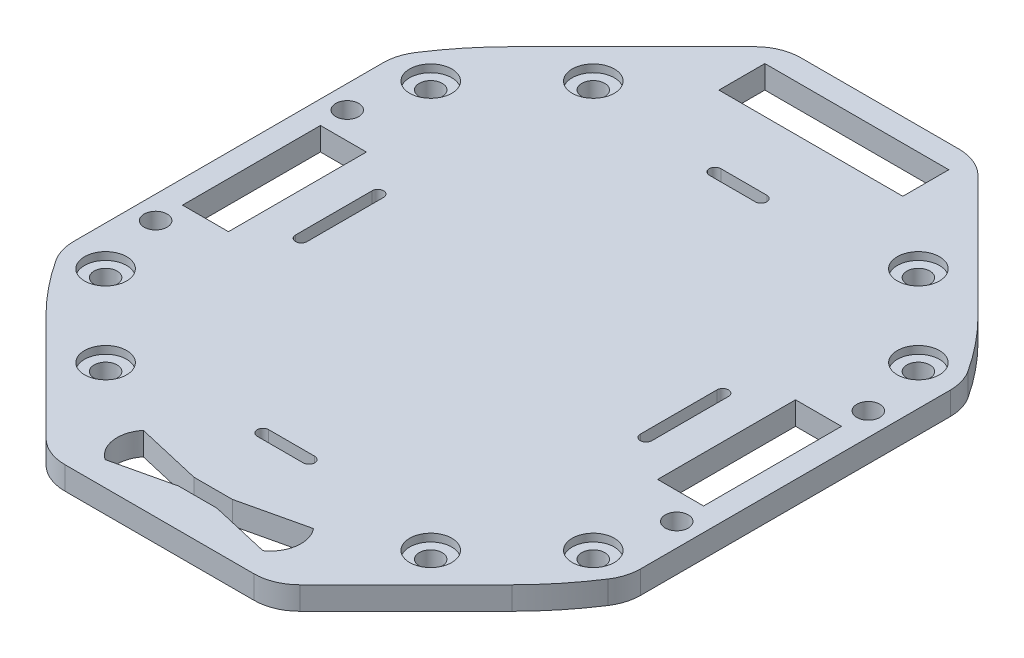
from build123d import *

# Parameters (mm, degrees)
SKETCH_1_R          = 1.5
EXTRUDE_1_DEPTH     = 3
SKETCH_2_R          = 2.75
CUT_EXTRUDE_1_DEPTH = 1
SKETCH_3_R          = 1.5
SKETCH_3_W          = 24
SKETCH_3_H          = 6
SKETCH_3_W_2        = 6
SKETCH_3_H_2        = 18
CUT_EXTRUDE_2_DEPTH = 10
CUT_EXTRUDE_3_DEPTH = 10
EXTRUDE_2_DEPTH     = 3
CUT_EXTRUDE_4_DEPTH = 3


with BuildPart() as part:
    # 草图1 → 凸台-拉伸1 (new body)
    with BuildSketch(Plane(origin=(0, 0, 0), x_dir=(1, 0, 0), z_dir=(0, 1, 0))):
        with BuildLine():
            Line((-10.325901808, 48), (10.325901808, 48))
            ThreePointArc((10.325901808, 48), (12.622002402, 47.543277195), (14.568542495, 46.242640687))
            Line((14.568542495, 46.242640687), (30.405591591, 30.405591591))
            ThreePointArc((30.405591591, 30.405591591), (33.396603497, 27.086285733), (36.027027027, 23.474524992))
            ThreePointArc((36.027027027, 23.474524992), (36.751615519, 21.907494269), (37, 20.199009877))
            Line((37, 20.199009877), (37, -20.199009877))
            ThreePointArc((37, -20.199009877), (36.751615519, -21.907494269), (36.027027027, -23.474524992))
            ThreePointArc((36.027027027, -23.474524992), (33.396603497, -27.086285733), (30.405591591, -30.405591591))
            Line((30.405591591, -30.405591591), (14.568542495, -46.242640687))
            ThreePointArc((14.568542495, -46.242640687), (12.622002402, -47.543277195), (10.325901808, -48))
            Line((10.325901808, -48), (-10.325901808, -48))
            ThreePointArc((-10.325901808, -48), (-12.622002402, -47.543277195), (-14.568542495, -46.242640687))
            Line((-14.568542495, -46.242640687), (-30.405591591, -30.405591591))
            ThreePointArc((-30.405591591, -30.405591591), (-33.396603497, -27.086285733), (-36.027027027, -23.474524992))
            ThreePointArc((-36.027027027, -23.474524992), (-36.751615519, -21.907494269), (-37, -20.199009877))
            Line((-37, -20.199009877), (-37, 20.199009877))
            ThreePointArc((-37, 20.199009877), (-36.751615519, 21.907494269), (-36.027027027, 23.474524992))
            ThreePointArc((-36.027027027, 23.474524992), (-33.396603497, 27.086285733), (-30.405591591, 30.405591591))
            Line((-30.405591591, 30.405591591), (-14.568542495, 46.242640687))
            ThreePointArc((-14.568542495, 46.242640687), (-12.622002402, 47.543277195), (-10.325901808, 48))
        make_face()
        with Locations((-21.213203436, 31.819805153)):
            Circle(SKETCH_1_R, mode=Mode.SUBTRACT)
        with Locations((-31.819805153, 21.213203436)):
            Circle(SKETCH_1_R, mode=Mode.SUBTRACT)
        with Locations((31.819805153, 21.213203436)):
            Circle(SKETCH_1_R, mode=Mode.SUBTRACT)
        with Locations((21.213203436, 31.819805153)):
            Circle(SKETCH_1_R, mode=Mode.SUBTRACT)
        with Locations((-31.819805153, -21.213203436)):
            Circle(SKETCH_1_R, mode=Mode.SUBTRACT)
        with Locations((-21.213203436, -31.819805153)):
            Circle(SKETCH_1_R, mode=Mode.SUBTRACT)
        with Locations((31.819805153, -21.213203436)):
            Circle(SKETCH_1_R, mode=Mode.SUBTRACT)
        with Locations((21.213203436, -31.819805153)):
            Circle(SKETCH_1_R, mode=Mode.SUBTRACT)
    extrude(amount=EXTRUDE_1_DEPTH)

    # 草图2 → 切除-拉伸1 (cut)
    with BuildSketch(Plane(origin=(0, 3, 0), x_dir=(1, 0, 0), z_dir=(0, 1, 0))):
        with Locations((-21.213203436, 31.819805153)):
            Circle(SKETCH_2_R)
        with Locations((-31.819805153, 21.213203436)):
            Circle(SKETCH_2_R)
        with Locations((21.213203436, 31.819805153)):
            Circle(SKETCH_2_R)
        with Locations((31.819805153, 21.213203436)):
            Circle(SKETCH_2_R)
        with Locations((-31.819805153, -21.213203436)):
            Circle(SKETCH_2_R)
        with Locations((-21.213203436, -31.819805153)):
            Circle(SKETCH_2_R)
        with Locations((21.213203436, -31.819805153)):
            Circle(SKETCH_2_R)
        with Locations((31.819805153, -21.213203436)):
            Circle(SKETCH_2_R)
    extrude(amount=-CUT_EXTRUDE_1_DEPTH, mode=Mode.SUBTRACT)

    # 草图3 → 切除-拉伸2 (cut)
    with BuildSketch(Plane(origin=(0, 3, 0), x_dir=(1, 0, 0), z_dir=(0, 1, 0))):
        with Locations((-34, 12.5)):
            Circle(SKETCH_3_R)
        with Locations((-34, -12.5)):
            Circle(SKETCH_3_R)
        with Locations((34, 12.5)):
            Circle(SKETCH_3_R)
        with Locations((34, -12.5)):
            Circle(SKETCH_3_R)
        with Locations((0, -40)):
            Rectangle(SKETCH_3_W, SKETCH_3_H)
        with Locations((0, 42)):
            Rectangle(SKETCH_3_W, SKETCH_3_H)
        with Locations((31, 0)):
            Rectangle(SKETCH_3_W_2, SKETCH_3_H_2)
        with Locations((-31, 0)):
            Rectangle(SKETCH_3_W_2, SKETCH_3_H_2)
    extrude(amount=-CUT_EXTRUDE_2_DEPTH, mode=Mode.SUBTRACT)

    # 草图4 → 切除-拉伸3 (cut)
    with BuildSketch(Plane.XZ):
        with BuildLine():
            Line((-12.325901808, 46), (12.325901808, 46))
            ThreePointArc((12.325901808, 46), (14.622002402, 45.543277195), (16.568542495, 44.242640687))
            Line((16.568542495, 44.242640687), (16.568542495, 49))
            Line((16.568542495, 49), (-16.568542495, 49))
            Line((-16.568542495, 49), (-16.568542495, 44.242640687))
            ThreePointArc((-16.568542495, 44.242640687), (-14.622002402, 45.543277195), (-12.325901808, 46))
        make_face()
    extrude(amount=-CUT_EXTRUDE_3_DEPTH, mode=Mode.SUBTRACT)

    # 草图5 → 凸台-拉伸2 (add)
    with BuildSketch(Plane.XZ):
        Polygon((-12, 37), (-12, 36), (12, 36), (12, 37), (13, 37), (13, 43), (12, 43), (12, 44), (-12, 44), (-12, 43), (-13, 43), (-13, 37), align=None)
        with BuildLine():
            Line((-10.3, 42.808101317), (-2.5, 41))
            Line((-2.5, 41), (2.5, 41))
            Line((2.5, 41), (10.3, 42.808101317))
            ThreePointArc((10.3, 42.808101317), (11.962490365, 40.08199487), (11.1, 37.007642751))
            Line((11.1, 37.007642751), (2.5, 39))
            Line((2.5, 39), (-2.5, 39))
            Line((-2.5, 39), (-11.1, 37.007642751))
            ThreePointArc((-11.1, 37.007642751), (-11.962490365, 40.08199487), (-10.3, 42.808101317))
        make_face(mode=Mode.SUBTRACT)
    extrude(amount=-EXTRUDE_2_DEPTH)

    # 草图6 → 切除-拉伸4 (cut)
    with BuildSketch(Plane.XZ):
        with BuildLine():
            Line((-21.75, 5), (-21.75, -5))
            ThreePointArc((-21.75, -5), (-22.5, -5.75), (-23.25, -5))
            Line((-23.25, -5), (-23.25, 5))
            ThreePointArc((-23.25, 5), (-22.5, 5.75), (-21.75, 5))
        make_face()
        with BuildLine():
            Line((-3, 30.25), (3, 30.25))
            ThreePointArc((3, 30.25), (3.75, 29.5), (3, 28.75))
            Line((3, 28.75), (-3, 28.75))
            ThreePointArc((-3, 28.75), (-3.75, 29.5), (-3, 30.25))
        make_face()
        with BuildLine():
            Line((-3, -30.25), (3, -30.25))
            ThreePointArc((3, -30.25), (3.75, -29.5), (3, -28.75))
            Line((3, -28.75), (-3, -28.75))
            ThreePointArc((-3, -28.75), (-3.75, -29.5), (-3, -30.25))
        make_face()
        with BuildLine():
            Line((21.75, 5), (21.75, -5))
            ThreePointArc((21.75, -5), (22.5, -5.75), (23.25, -5))
            Line((23.25, -5), (23.25, 5))
            ThreePointArc((23.25, 5), (22.5, 5.75), (21.75, 5))
        make_face()
    extrude(amount=-CUT_EXTRUDE_4_DEPTH, mode=Mode.SUBTRACT)


solid = part.part
